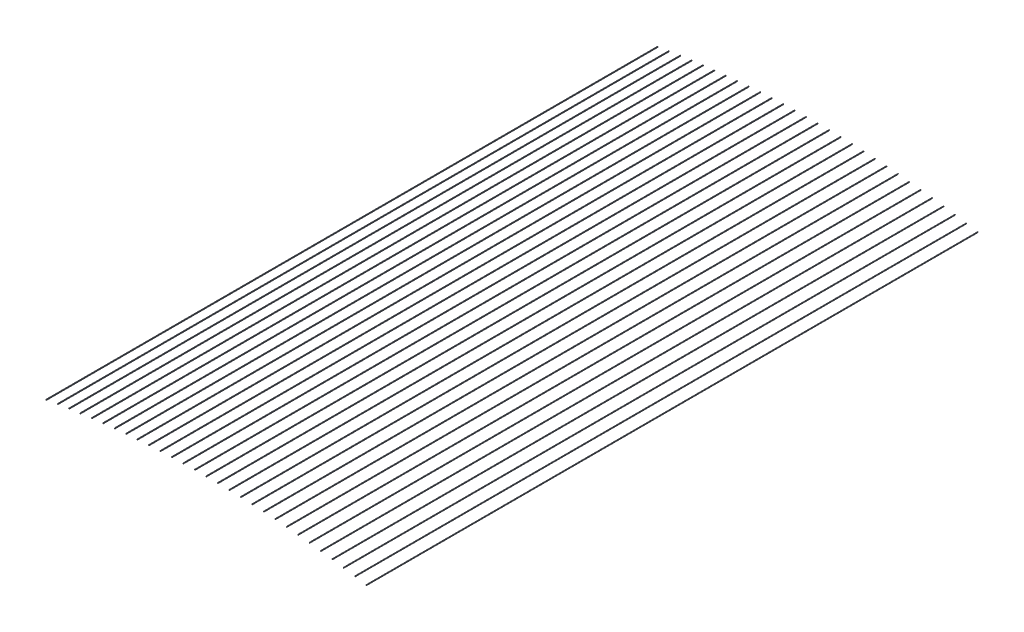
from build123d import *

# Parameters (mm, degrees)
SKETCH2_W             = 40
SKETCH2_H             = 75
BOSS_EXTRUDE1_DEPTH   = 64922.4
BODY_MOVE_COPY1_ANGLE = 15
BODY_MOVE_COPY2_ANGLE = 2
BODY_MOVE_COPY3_ANGLE = 3.5
SHELL1_T              = -3
CRVPATTERN1_DEPTH     = 64922.4


# Read off the part's stored shape, not the designer's step: CrvPattern1
with BuildPart() as part:
    # Sketch2 → Boss-Extrude1 (new body)
    with BuildSketch(Plane.XY):
        with Locations((-16838.209654662, 109.301180947)):
            Rectangle(SKETCH2_W, SKETCH2_H)
    extrude(amount=BOSS_EXTRUDE1_DEPTH)


with BuildPart() as part_1:
    # Body-Move/Copy1: moved
    add(part.part.rotate(Axis((-16838.209654662, 109.301180947, 0), (0, 0, 1)), BODY_MOVE_COPY1_ANGLE))


with BuildPart() as part_2:
    # Body-Move/Copy2: moved
    add(part_1.part.rotate(Axis((-16838.209654662, 109.301180947, 0), (0, 0, -1)), BODY_MOVE_COPY2_ANGLE))


with BuildPart() as part_3:
    # Body-Move/Copy3: moved
    add(part_2.part.rotate(Axis((-16838.209654662, 109.301180947, 0), (0, 0, -1)), BODY_MOVE_COPY3_ANGLE))

    # Shell1
    shell1_openings = [part_3.faces().sort_by_distance(p)[0] for p in [
        (-16838.209654662, 109.301180947, 64922.4),
        (-16838.209654662, 109.301180947, 0),
    ]]
    offset(amount=SHELL1_T, openings=shell1_openings, kind=Kind.INTERSECTION)


with BuildPart() as body_2:
    # CrvPattern1 outline → CrvPattern1 (new body)
    # profile 1 of 28: a face of its own
    with BuildSketch(Plane.XY):
        Polygon((17128.426181289, 96.523185418), (17114.834698556, 22.764988605), (17154.172403523, 15.516197814), (17167.763886256, 89.274394627), align=None)
        Polygon((17151.76573496, 19.010184996), (17118.328685738, 25.171657168), (17130.832849852, 93.029198236), (17164.269899074, 86.867726064), align=None, mode=Mode.SUBTRACT)
    # profile 2 of 28: a face of its own
    with BuildSketch(Plane.XY):
        Polygon((15925.682076824, 301.952919266), (15913.008416073, 228.031485817), (15952.433180579, 221.272200083), (15965.10684133, 295.193633532), align=None)
        Polygon((15949.983269671, 224.736003851), (15916.472219841, 230.481396725), (15928.131987732, 298.489115498), (15961.643037562, 292.743722624), align=None, mode=Mode.SUBTRACT)
    # profile 3 of 28: a face of its own
    with BuildSketch(Plane.XY):
        Polygon((14720.477508586, 492.417364954), (14708.723627853, 418.344115479), (14748.229360907, 412.075379089), (14759.983241639, 486.148628563), align=None)
        Polygon((14745.736586157, 415.508464297), (14712.156713062, 420.836890229), (14722.970283336, 488.984279746), (14756.550156431, 483.655853814), align=None, mode=Mode.SUBTRACT)
    # profile 4 of 28: a face of its own
    with BuildSketch(Plane.XY):
        Polygon((13512.998676585, 667.887096372), (13502.166391806, 593.673474937), (13541.746989905, 587.896256389), (13552.579274684, 662.109877824), align=None)
        Polygon((13539.211736439, 591.298092637), (13505.568228055, 596.208728404), (13515.533930051, 664.485260124), (13549.177438435, 659.574624357), align=None, mode=Mode.SUBTRACT)
    # profile 5 of 28: a face of its own
    with BuildSketch(Plane.XY):
        Polygon((12303.432132199, 828.335004043), (12293.523116925, 753.992476401), (12333.172465001, 748.707668255), (12343.081480275, 823.050195897), align=None)
        Polygon((12330.595124507, 752.077729971), (12296.893178642, 756.569816895), (12306.009472694, 824.964942327), (12339.711418558, 820.472855403), align=None, mode=Mode.SUBTRACT)
    # profile 6 of 28: a face of its own
    with BuildSketch(Plane.XY):
        Polygon((11091.964749349, 973.736299311), (11082.98053449, 899.276351128), (11122.692506854, 894.48476987), (11131.676721713, 968.944718052), align=None)
        Polygon((11120.073477521, 897.822536392), (11086.318301011, 901.895380461), (11094.583778682, 970.398532789), (11128.338955192, 966.32568872), align=None, mode=Mode.SUBTRACT)
    # profile 7 of 28: a face of its own
    with BuildSketch(Plane.XY):
        Polygon((9878.783695631, 1104.068518169), (9870.725669216, 1029.502653255), (9910.494130503, 1025.205039167), (9918.552156918, 1099.770904081), align=None)
        Polygon((9907.833816963, 1028.50999482), (9874.030624869, 1032.162966795), (9881.444009171, 1100.763562516), (9915.247201265, 1097.110590541), align=None, mode=Mode.SUBTRACT)
    # profile 8 of 28: a face of its own
    with BuildSketch(Plane.XY):
        Polygon((8664.076403394, 1219.311524732), (8656.945810362, 1144.65126326), (8696.76461648, 1140.848280309), (8703.895209512, 1215.508541781), align=None)
        Polygon((8694.063429742, 1144.11991449), (8660.217444542, 1147.352449998), (8666.777590132, 1216.039890551), (8700.623575332, 1212.807355043), align=None, mode=Mode.SUBTRACT)
    # profile 9 of 28: a face of its own
    with BuildSketch(Plane.XY):
        Polygon((7448.03054079, 1319.447514347), (7441.828482792, 1244.704391074), (7481.691481871, 1241.396626808), (7487.893539869, 1316.139750081), align=None)
        Polygon((7478.94983926, 1244.634434059), (7445.066290043, 1247.446033685), (7450.772183401, 1316.209707096), (7484.655732618, 1313.39810747), align=None, mode=Mode.SUBTRACT)
    # profile 10 of 28: a face of its own
    with BuildSketch(Plane.XY):
        Polygon((6230.833982771, 1404.461016344), (6225.561418005, 1329.646578828), (6265.462451347, 1326.834544286), (6270.735016113, 1401.648981802), align=None)
        Polygon((6262.680776437, 1330.038024378), (6228.764898096, 1332.428253738), (6233.615657681, 1401.257536253), (6267.531536022, 1398.867306892), align=None, mode=Mode.SUBTRACT)
    # profile 11 of 28: a face of its own
    with BuildSketch(Plane.XY):
        Polygon((5012.674782071, 1474.338896426), (5008.332525131, 1399.464703244), (5048.265428161, 1397.148832875), (5052.607685102, 1472.023026058), align=None)
        Polygon((5045.444150711, 1400.31749088), (5011.501183136, 1402.285980694), (5015.496059521, 1471.170238421), (5049.439027097, 1469.201748608), align=None, mode=Mode.SUBTRACT)
    # profile 12 of 28: a face of its own
    with BuildSketch(Plane.XY):
        Polygon((3793.741140148, 1529.070358698), (3790.329861897, 1454.147977658), (3830.288465118, 1452.328629257), (3833.69974337, 1527.251010297), align=None)
        Polygon((3827.428021006, 1455.461975629), (3793.463208268, 1457.008421769), (3796.60158426, 1525.937012326), (3830.566396998, 1524.390566185), align=None, mode=Mode.SUBTRACT)
    # profile 13 of 28: a face of its own
    with BuildSketch(Plane.XY):
        Polygon((2574.221378108, 1568.646947334), (2571.741605577, 1493.68795369), (2611.71973552, 1492.365408339), (2614.199508052, 1567.324401984), align=None)
        Polygon((2608.820566676, 1495.462958987), (2574.839156224, 1496.587122534), (2577.120546953, 1565.549396687), (2611.101957405, 1564.425233139), align=None, mode=Mode.SUBTRACT)
    # profile 14 of 28: a face of its own
    with BuildSketch(Plane.XY):
        Polygon((1354.303907611, 1593.062547887), (1352.756023916, 1518.078522548), (1392.747504097, 1517.252984577), (1394.295387792, 1592.237009916), align=None)
        Polygon((1389.810058431, 1520.314260938), (1355.817300278, 1521.015968214), (1357.241353277, 1590.001271526), (1391.234111431, 1589.29956425), align=None, mode=Mode.SUBTRACT)
    # profile 15 of 28: a face of its own
    with BuildSketch(Plane.XY):
        Polygon((134.177201762, 1602.313388229), (133.561446046, 1527.315915972), (173.560097916, 1526.987512923), (174.175853632, 1601.98498518), align=None)
        Polygon((170.584829254, 1530.012042042), (136.585975165, 1530.291184634), (137.152470424, 1599.28885911), (171.151324513, 1599.009716519), align=None, mode=Mode.SUBTRACT)
    # profile 16 of 28: a face of its own
    with BuildSketch(Plane.XY):
        Polygon((-1085.970234009, 1596.398039136), (-1085.653766614, 1521.398706817), (-1045.65412271, 1521.567489427), (-1045.970590105, 1596.566821747), align=None)
        Polygon((-1048.666754699, 1524.554804024), (-1082.666452017, 1524.411338805), (-1082.957602021, 1593.410724539), (-1048.957904702, 1593.554189758), align=None, mode=Mode.SUBTRACT)
    # profile 17 of 28: a face of its own
    with BuildSketch(Plane.XY):
        Polygon((-2305.949891069, 1575.31741451), (-2304.701249456, 1500.32780927), (-2264.706793327, 1500.993751464), (-2265.955434941, 1575.983356704), align=None)
        Polygon((-2267.756323201, 1503.943390009), (-2301.751610911, 1503.377339144), (-2302.900361195, 1572.367775965), (-2268.905073486, 1572.93382683), align=None, mode=Mode.SUBTRACT)
    # profile 18 of 28: a face of its own
    with BuildSketch(Plane.XY):
        Polygon((-3525.573286705, 1539.074771236), (-3523.392663784, 1464.106478714), (-3483.409574439, 1465.269477605), (-3485.59019736, 1540.237770127), align=None)
        Polygon((-3486.495531057, 1468.180984389), (-3520.481157, 1467.192435332), (-3522.487330087, 1536.163264452), (-3488.501704144, 1537.15181351), align=None, mode=Mode.SUBTRACT)
    # profile 19 of 28: a face of its own
    with BuildSketch(Plane.XY):
        Polygon((-4744.651993246, 1487.67570868), (-4741.539725917, 1412.740311222), (-4701.574180607, 1414.400187131), (-4704.686447936, 1489.335584588), align=None)
        Polygon((-4704.696087198, 1417.273112336), (-4738.666800712, 1415.862217814), (-4741.530086655, 1484.802783474), (-4707.559373141, 1486.213677997), align=None, mode=Mode.SUBTRACT)
    # profile 20 of 28: a face of its own
    with BuildSketch(Plane.XY):
        Polygon((-5962.997667174, 1421.12816782), (-5958.954236272, 1346.237242692), (-5919.012409537, 1348.393739174), (-5923.055840439, 1423.284664302), align=None)
        Polygon((-5922.169783778, 1351.227638943), (-5956.120336503, 1349.394616933), (-5959.840292933, 1418.294268051), (-5925.889740208, 1420.12729006), align=None, mode=Mode.SUBTRACT)
    # profile 21 of 28: a face of its own
    with BuildSketch(Plane.XY):
        Polygon((-7180.422078222, 1339.442430027), (-7175.448108442, 1264.607547622), (-7135.536171159, 1267.260331505), (-7140.510140939, 1342.09521391), align=None)
        Polygon((-7138.728525247, 1270.05476801), (-7172.653671937, 1267.799901709), (-7177.229724135, 1336.647993522), (-7143.304577444, 1338.902859823), align=None, mode=Mode.SUBTRACT)
    # profile 22 of 28: a face of its own
    with BuildSketch(Plane.XY):
        Polygon((-8396.737138454, 1242.63111547), (-8390.833398258, 1167.863837522), (-8350.957516686, 1171.01249896), (-8356.861256882, 1245.779776908), align=None)
        Polygon((-8354.184357412, 1173.76704047), (-8388.078856748, 1171.090678248), (-8393.510297729, 1239.87657396), (-8359.615798392, 1242.552936182), align=None, mode=Mode.SUBTRACT)
    # profile 23 of 28: a face of its own
    with BuildSketch(Plane.XY):
        Polygon((-9611.754931327, 1130.709181167), (-9604.922332822, 1056.021058968), (-9565.088667649, 1059.665111504), (-9571.921266154, 1134.353233703), align=None)
        Polygon((-9568.349496477, 1062.379332451), (-9602.208111875, 1059.281887796), (-9608.494102499, 1127.99496022), (-9574.635487101, 1131.092404875), align=None, mode=Mode.SUBTRACT)
    # profile 24 of 28: a face of its own
    with BuildSketch(Plane.XY):
        Polygon((-10825.287740718, 1003.693918678), (-10817.527339519, 929.096491288), (-10777.742044911, 933.235371927), (-10785.50244611, 1007.832799318), align=None)
        Polygon((-10781.036358054, 935.908852975), (-10814.853858471, 932.390804431), (-10821.993427574, 1001.02043763), (-10788.175927157, 1004.538486174), align=None, mode=Mode.SUBTRACT)
    # profile 25 of 28: a face of its own
    with BuildSketch(Plane.XY):
        Polygon((-12037.148079932, 861.604951428), (-12028.461074993, 787.109743897), (-11988.730297643, 791.742813197), (-11997.417302582, 866.238020729), align=None)
        Polygon((-11992.057586142, 794.375141301), (-12025.82874689, 790.437032396), (-12033.820791433, 858.972623325), (-12000.049630685, 862.91073223), align=None, mode=Mode.SUBTRACT)
    # profile 26 of 28: a face of its own
    with BuildSketch(Plane.XY):
        Polygon((-13247.148720664, 704.464231681), (-13237.536454099, 630.082753265), (-13197.866332276, 635.209295433), (-13207.478598841, 709.590773849), align=None)
        Polygon((-13201.226082076, 637.800063907), (-13234.945685625, 633.442503064), (-13243.788970864, 701.873463207), (-13210.069367315, 706.23102405), align=None, mode=Mode.SUBTRACT)
    # profile 27 of 28: a face of its own
    with BuildSketch(Plane.XY):
        Polygon((-14455.102721925, 532.296037144), (-14444.566678796, 458.039779528), (-14404.963341401, 463.65900253), (-14415.49938453, 537.915260146), align=None)
        Polygon((-14408.355033431, 466.207811109), (-14442.017870217, 461.431471558), (-14451.711029896, 529.747228565), (-14418.048193109, 534.523568116), align=None, mode=Mode.SUBTRACT)
    # profile 28 of 28: a face of its own
    with BuildSketch(Plane.XY):
        Polygon((-15660.823458927, 345.126967218), (-15649.365267017, 271.007402742), (-15609.83483263, 277.118438427), (-15621.29302454, 351.238002903), align=None)
        Polygon((-15613.257942885, 279.62489333), (-15646.858812115, 274.430512997), (-15657.400348672, 342.620512315), (-15623.799479443, 347.814892648), align=None, mode=Mode.SUBTRACT)
    extrude(amount=CRVPATTERN1_DEPTH)


solid = Compound([part_3.part, body_2.part])
